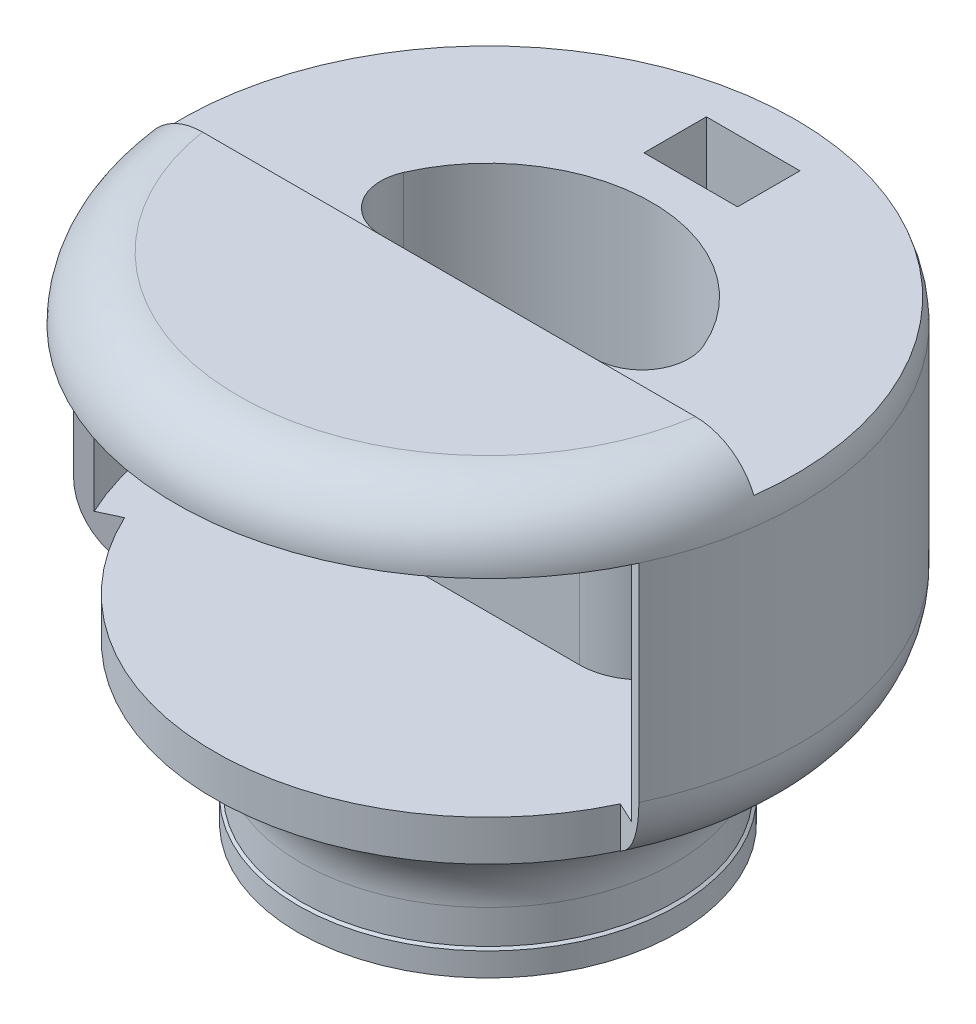
from build123d import *

# Parameters (mm, degrees)
CUT_EXTRUDE3_DEPTH           = 60
CUT_EXTRUDE5_DEPTH           = 2
CUT_EXTRUDE5_DEPTH_BACK      = 30
SKETCH9_R                    = 38
SKETCH9_R_2                  = 23
SKETCH19_W                   = 12
SKETCH19_H                   = 36.5
CUT_REVOLVE2_ANGLE           = 65
CUT_REVOLVE2_OTHER_WAY_ANGLE = 65
SKETCH21_W                   = 3.25
SKETCH21_H                   = 4
BOSS_EXTRUDE3_DEPTH          = 1.35
CIRPATTERN1_COUNT            = 5
CUT_EXTRUDE9_START           = -5
CUT_EXTRUDE9_DEPTH           = 5
SKETCH23_R                   = 10.5
CUT_EXTRUDE10_DEPTH          = 10
SKETCH24_W                   = 17
SKETCH24_H                   = 12
BOSS_EXTRUDE4_DEPTH          = 8
SKETCH26_W                   = 12
SKETCH26_H                   = 8
CUT_EXTRUDE11_DEPTH          = 10
SKETCH27_W                   = 4
SKETCH27_H                   = 5
CUT_EXTRUDE12_DEPTH          = 5
CUT_EXTRUDE14_DEPTH          = 2
CUT_EXTRUDE14_DEPTH_BACK     = 30
SKETCH29_R                   = 1
CUT_EXTRUDE15_DEPTH          = 15
FILLET1_R                    = 6
FILLET2_R                    = 8
SKETCH30_W                   = 97.703590575
SKETCH30_H                   = 5
CUT_EXTRUDE16_DEPTH          = 5


with BuildPart() as part:
    # Sketch1 → Revolve1 (revolve)
    with BuildSketch(Plane.XY):
        with BuildLine():
            Line((0, 63.427876097), (32, 63.427876097))
            ThreePointArc((32, 63.427876097), (37.656854249, 61.084730346), (40, 55.427876097))
            Line((40, 55.427876097), (40, 28.846818009))
            ThreePointArc((40, 28.846818009), (38.792081772, 24.082439968), (35.460140376, 20.469057744))
            Line((35.460140376, 20.469057744), (28.539859624, 15.958818353))
            ThreePointArc((28.539859624, 15.958818353), (25.207918228, 12.345436129), (24, 7.581058088))
            Line((24, 7.581058088), (24, 3.25))
            Line((24, 3.25), (24.35, 3))
            Line((24.35, 3), (24.35, 0))
            Line((24.35, 0), (22.5, 0))
            Line((22.5, 0), (22.5, 12.5))
            ThreePointArc((22.5, 12.5), (22.353553391, 12.853553391), (22, 13))
            Line((22, 13), (0, 13))
            Line((0, 13), (0, 63.427876097))
        make_face()
    revolve(axis=Axis((0, 0, 0), (0, 1, 0)))

    # Sketch11 → Cut-Extrude3 (cut)
    with BuildSketch(Plane(origin=(0, 13, 0), x_dir=(-1, 0, 0), z_dir=(0, -1, 0))):
        with BuildLine():
            Line((-21, 0), (21, 0))
            ThreePointArc((21, 0), (0, 21), (-21, 0))
        make_face()
    extrude(amount=-CUT_EXTRUDE3_DEPTH, mode=Mode.SUBTRACT)

    # Sketch9 → Cut-Extrude5 (cut, two sides: drawn at the far end of the back side and taken through both)
    with BuildSketch(Plane(origin=(0, 55.427876097, 0), x_dir=(1, 0, 0), z_dir=(0, 1, 0)).offset(-CUT_EXTRUDE5_DEPTH_BACK)):
        Circle(SKETCH9_R)
        Circle(SKETCH9_R_2, mode=Mode.SUBTRACT)
    extrude(amount=CUT_EXTRUDE5_DEPTH + CUT_EXTRUDE5_DEPTH_BACK, mode=Mode.SUBTRACT)

    # Sketch19 → Cut-Revolve2 (revolve, cut)
    with BuildSketch(Plane(origin=(0, 0, 0), x_dir=(0, 0, -1), z_dir=(1, 0, 0))):
        with Locations((-41.064715832, 37.177876097)):
            Rectangle(SKETCH19_W, SKETCH19_H)
    revolve(axis=Axis((0, 0, 0), (0, 1, 0)), revolution_arc=CUT_REVOLVE2_ANGLE, mode=Mode.SUBTRACT)

    # Sketch19 → Cut-Revolve2 other way (revolve, cut)
    with BuildSketch(Plane(origin=(0, 0, 0), x_dir=(0, 0, -1), z_dir=(1, 0, 0))):
        with Locations((-41.064715832, 37.177876097)):
            Rectangle(SKETCH19_W, SKETCH19_H)
    revolve(axis=Axis((0, 0, 0), (0, -1, 0)), revolution_arc=CUT_REVOLVE2_OTHER_WAY_ANGLE, mode=Mode.SUBTRACT)

    # Sketch21 → Boss-Extrude3 (add)
    with BuildSketch(Plane(origin=(0, 0, 22.5), x_dir=(-1, 0, 0), z_dir=(0, 0, -1))):
        with Locations((0, 2)):
            Rectangle(SKETCH21_W, SKETCH21_H)
    boss_extrude3 = extrude(amount=BOSS_EXTRUDE3_DEPTH)

    # CirPattern1: Boss-Extrude3 ×5 about axis
    cirpattern1_axis = Axis((0, 0, 0), (0, -1, 0))
    for i in range(1, CIRPATTERN1_COUNT):
        add(boss_extrude3.rotate(cirpattern1_axis, i * 360 / CIRPATTERN1_COUNT))

    # Sketch22 → Cut-Extrude9 (cut)
    with BuildSketch(Plane(origin=(0, 63.427876097, 0), x_dir=(1, 0, 0), z_dir=(0, 1, 0)).offset(CUT_EXTRUDE9_START)):
        with BuildLine():
            Line((-40, 0), (40, 0))
            ThreePointArc((40, 0), (0, 40), (-40, 0))
        make_face()
    extrude(amount=CUT_EXTRUDE9_DEPTH, mode=Mode.SUBTRACT)

    # Sketch23 → Cut-Extrude10 (cut)
    with BuildSketch(Plane(origin=(0, 0, -40), x_dir=(-1, 0, 0), z_dir=(0, 0, -1))):
        with Locations((0, 42.137876097)):
            Circle(SKETCH23_R)
    extrude(amount=-CUT_EXTRUDE10_DEPTH, mode=Mode.SUBTRACT)

    # Sketch24 → Boss-Extrude4 (add)
    with BuildSketch(Plane(origin=(0, 58.427876097, 0), x_dir=(1, 0, 0), z_dir=(0, 1, 0))):
        with Locations((0, 30)):
            Rectangle(SKETCH24_W, SKETCH24_H)
    extrude(amount=-BOSS_EXTRUDE4_DEPTH)

    # Sketch26 → Cut-Extrude11 (cut)
    with BuildSketch(Plane(origin=(0, 58.427876097, 0), x_dir=(1, 0, 0), z_dir=(0, 1, 0))):
        with Locations((0, 30)):
            Rectangle(SKETCH26_W, SKETCH26_H)
    extrude(amount=-CUT_EXTRUDE11_DEPTH, mode=Mode.SUBTRACT)

    # Sketch27 → Cut-Extrude12 (cut)
    with BuildSketch(Plane(origin=(8.5, 0, 0), x_dir=(0, 0, -1), z_dir=(1, 0, 0))):
        with Locations((29.5, 53.927876097)):
            Rectangle(SKETCH27_W, SKETCH27_H)
    extrude(amount=-CUT_EXTRUDE12_DEPTH, mode=Mode.SUBTRACT)

    # Sketch28 → Cut-Extrude14 (cut, two sides: drawn at the far end of the back side and taken through both)
    with BuildSketch(Plane(origin=(0, 55.427876097, 0), x_dir=(1, 0, 0), z_dir=(0, 1, 0)).offset(-CUT_EXTRUDE14_DEPTH_BACK)):
        with BuildLine():
            Line((-22.912878475, -2), (22.912878475, -2))
            ThreePointArc((22.912878475, -2), (0, -23), (-22.912878475, -2))
        make_face()
    extrude(amount=CUT_EXTRUDE14_DEPTH + CUT_EXTRUDE14_DEPTH_BACK, mode=Mode.SUBTRACT)

    # Sketch29 → Cut-Extrude15 (cut)
    with BuildSketch(Plane(origin=(0, 0, 0), x_dir=(-1, 0, 0), z_dir=(0, 0, -1))):
        with Locations((-30.416198487, 60.927876097)):
            Circle(SKETCH29_R)
        with Locations((30.416198487, 60.927876097)):
            Circle(SKETCH29_R)
        with Locations((0, 60.927876097)):
            Circle(SKETCH29_R)
    extrude(amount=-CUT_EXTRUDE15_DEPTH, mode=Mode.SUBTRACT)

    # Fillet1
    fillet1_edges = [part.edges().sort_by_distance(p)[0] for p in [
        (-21, 35.713938048, 0),
        (21, 35.713938048, 0),
    ]]
    fillet(fillet1_edges, radius=FILLET1_R)

    # Fillet2
    fillet2_edges = [part.edges().sort_by_distance(p)[0] for p in [
        (22.912878475, 41.427876097, 2),
        (-22.912878475, 41.427876097, 2),
    ]]
    fillet(fillet2_edges, radius=FILLET2_R)

    # Sketch30 → Cut-Extrude16 (cut)
    with BuildSketch(Plane(origin=(0, 63.427876097, 0), x_dir=(1, 0, 0), z_dir=(0, 1, 0))):
        with Locations((-0.528699084, -2.5)):
            Rectangle(SKETCH30_W, SKETCH30_H)
    extrude(amount=-CUT_EXTRUDE16_DEPTH, mode=Mode.SUBTRACT)


solid = part.part
